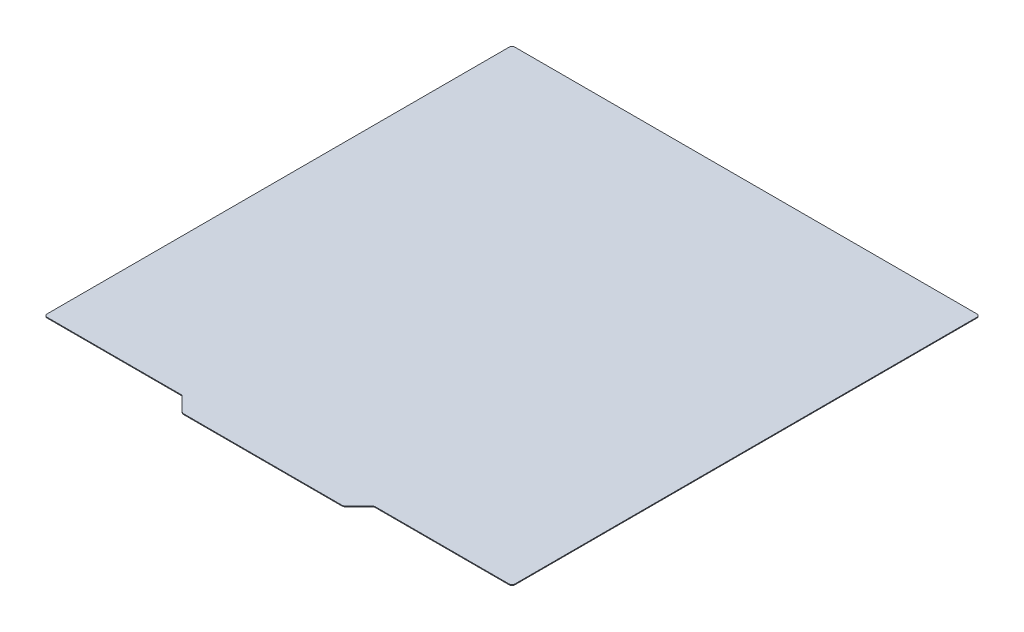
from build123d import *

# Parameters (mm, degrees)
BOSS_EXTRUDE1_DEPTH = 0.5
FILLET1_R           = 2


with BuildPart() as part:
    # Sketch1 → Boss-Extrude1 (new body)
    with BuildSketch(Plane(origin=(0, 0, 0), x_dir=(1, 0, 0), z_dir=(0, 1, 0))):
        Polygon((-52.5, -162.5), (52.5, -162.5), (62.5, -152.5), (152.5, -152.5), (152.5, 152.5), (-152.5, 152.5), (-152.5, -152.5), (-62.5, -152.5), align=None)
    extrude(amount=BOSS_EXTRUDE1_DEPTH)

    # Fillet1
    fillet1_edges = [part.edges().sort_by_distance(p)[0] for p in [
        (-152.5, 0.25, -152.5),
        (152.5, 0.25, -152.5),
        (152.5, 0.25, 152.5),
        (62.5, 0.25, 152.5),
        (-52.5, 0.25, 162.5),
        (-62.5, 0.25, 152.5),
        (-152.5, 0.25, 152.5),
        (52.5, 0.25, 162.5),
    ]]
    fillet(fillet1_edges, radius=FILLET1_R)


solid = part.part
